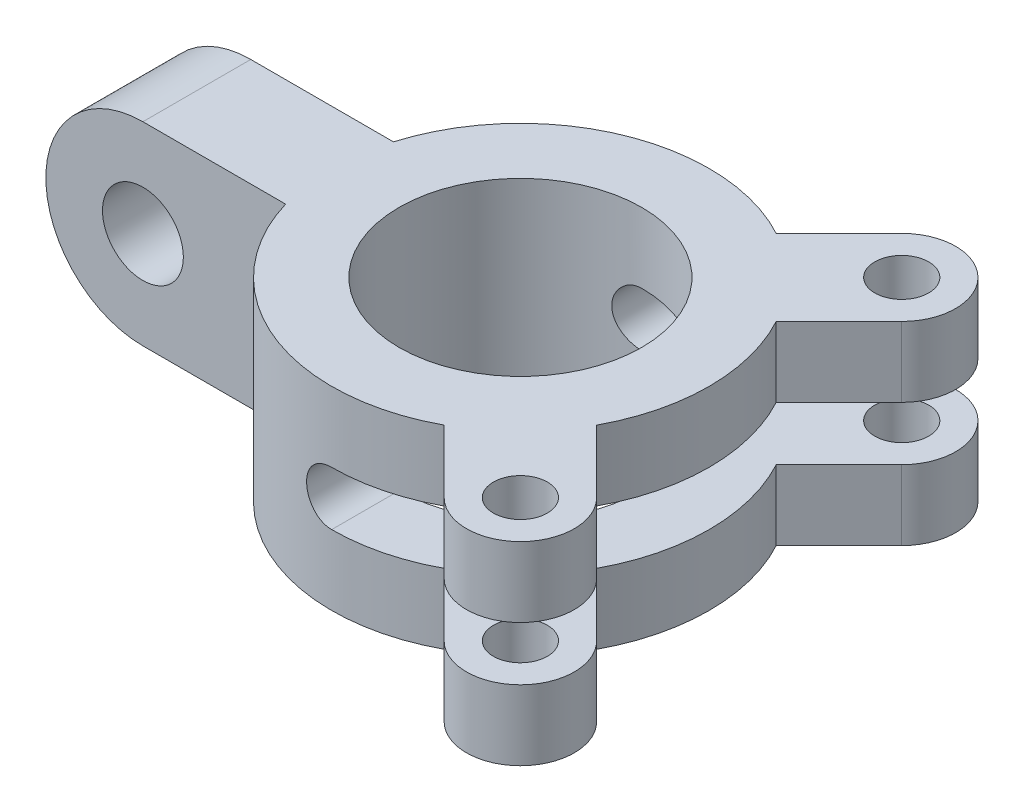
from build123d import *

# Parameters (mm, degrees)
SKETCH1_R               = 35
SKETCH1_R_2             = 22.5
BOSS_EXTRUDE1_DEPTH     = 18
CUT_EXTRUDE1_DEPTH      = 53.668776329
CUT_EXTRUDE1_DEPTH_BACK = 53.668776329
SKETCH2_R               = 5
SKETCH2_W               = 35
SKETCH2_H               = 10
BOSS_EXTRUDE2_START     = 18
SKETCH3_R               = 5
BOSS_EXTRUDE2_DEPTH     = 13
MIRROR2_START           = 18
MIRROR2_COPY_1_SKETCH_R = 5
MIRROR2_COPY_1_DEPTH    = 13
BOSS_EXTRUDE4_DEPTH     = 10


with BuildPart() as part:
    # Sketch1 → Boss-Extrude1 (new, symmetric)
    with BuildSketch(Plane(origin=(0, 0, 0), x_dir=(1, 0, 0), z_dir=(0, 1, 0))):
        Circle(SKETCH1_R)
        Circle(SKETCH1_R_2, mode=Mode.SUBTRACT)
    extrude(amount=BOSS_EXTRUDE1_DEPTH, both=True)

    # Sketch2 → Cut-Extrude1 (cut, two sides: drawn at the far end of the back side and taken through both)
    with BuildSketch(Plane.XY.offset(-CUT_EXTRUDE1_DEPTH_BACK)):
        Circle(SKETCH2_R)
        with Locations((17.5, 0)):
            Rectangle(SKETCH2_W, SKETCH2_H)
    extrude(amount=CUT_EXTRUDE1_DEPTH + CUT_EXTRUDE1_DEPTH_BACK, mode=Mode.SUBTRACT)

    # Sketch3 → Boss-Extrude2 (add)
    with BuildSketch(Plane(origin=(0, 0, 0), x_dir=(1, 0, 0), z_dir=(0, 1, 0)).offset(BOSS_EXTRUDE2_START)):
        with BuildLine():
            Line((28.284271247, -42.426406871), (16.646014639, -30.788150263))
            ThreePointArc((16.646014639, -30.788150263), (24.748737342, -24.748737342), (30.788150263, -16.646014639))
            Line((30.788150263, -16.646014639), (42.426406871, -28.284271247))
            ThreePointArc((42.426406871, -28.284271247), (42.426406871, -42.426406871), (28.284271247, -42.426406871))
        make_face()
        with Locations((35.355339059, -35.355339059)):
            Circle(SKETCH3_R, mode=Mode.SUBTRACT)
    boss_extrude2 = extrude(amount=-BOSS_EXTRUDE2_DEPTH)

    # Mirror1: Boss-Extrude2 across plane
    add(boss_extrude2.mirror(Plane.XY))

    # Mirror2: Boss-Extrude2 across plane
    add(boss_extrude2.mirror(Plane.ZX))

    # Mirror2 copy 1 sketch → Mirror2 copy 1 (add)
    with BuildSketch(Plane.XZ.offset(MIRROR2_START)):
        with BuildLine():
            Line((28.284271247, -42.426406871), (16.646014639, -30.788150263))
            ThreePointArc((16.646014639, -30.788150263), (24.748737342, -24.748737342), (30.788150263, -16.646014639))
            Line((30.788150263, -16.646014639), (42.426406871, -28.284271247))
            ThreePointArc((42.426406871, -28.284271247), (42.426406871, -42.426406871), (28.284271247, -42.426406871))
        make_face()
        with Locations((35.355339059, -35.355339059)):
            Circle(MIRROR2_COPY_1_SKETCH_R, mode=Mode.SUBTRACT)
    extrude(amount=-MIRROR2_COPY_1_DEPTH)

    # Sketch4 → Boss-Extrude4 (add, symmetric)
    with BuildSketch(Plane.XY):
        with BuildLine():
            Line((-22.5, 18), (-60, 18))
            ThreePointArc((-60, 18), (-78, 0), (-60, -18))
            Line((-60, -18), (-22.5, -18))
            Line((-22.5, -18), (-22.5, 18))
        make_face()
        with BuildLine():
            ThreePointArc((-67.5, 0), (-60, 7.5), (-52.5, 0))
            ThreePointArc((-52.5, 0), (-60, -7.5), (-67.5, 0))
        make_face(mode=Mode.SUBTRACT)
    extrude(amount=BOSS_EXTRUDE4_DEPTH, both=True)


solid = part.part
